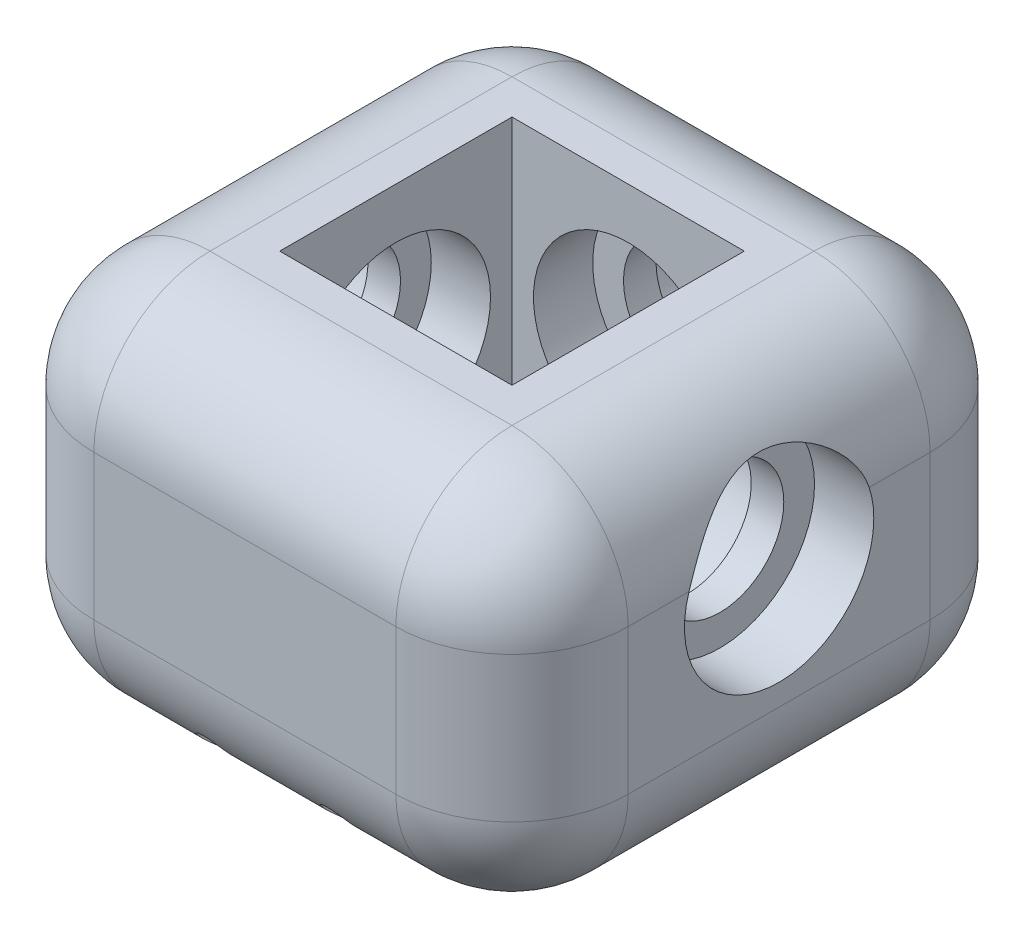
from build123d import *

# Parameters (mm, degrees)
BOSS_EXTRUDE1_DEPTH      = 12.5
BOSS_EXTRUDE1_DEPTH_BACK = 20
SKETCH2_R                = 8.15
CUT_EXTRUDE1_DEPTH       = 5.1
CUT_EXTRUDE2_START       = -5.1
SKETCH3_R                = 8.15
CUT_EXTRUDE2_DEPTH       = 5.1
SKETCH4_R                = 5.5
CUT_EXTRUDE3_DEPTH       = 100
SKETCH5_R                = 8.150000000000011
CUT_EXTRUDE4_DEPTH       = 5.1
CUT_EXTRUDE5_START       = -5.1
SKETCH6_R                = 8.150000000000006
CUT_EXTRUDE5_DEPTH       = 5.1
SKETCH7_R                = 8.15
CUT_EXTRUDE6_DEPTH       = 5.1
CUT_EXTRUDE7_START       = -5.1
SKETCH8_R                = 8.150000000000004
CUT_EXTRUDE7_DEPTH       = 5.1
SKETCH9_R                = 5.5
CUT_EXTRUDE8_DEPTH       = 5.1
FILLET1_R                = 10
BOSS_EXTRUDE2_DEPTH      = 6
SKETCH10_R               = 1.2999999999999996
CUT_EXTRUDE9_DEPTH       = 100
FILLET2_R                = 5


with BuildPart() as part:
    # Sketch1 → Boss-Extrude1 (new, two sides: drawn at the far end of the back side and taken through both)
    with BuildSketch(Plane(origin=(0, 0, 0), x_dir=(1, 0, 0), z_dir=(0, 1, 0)).offset(-BOSS_EXTRUDE1_DEPTH_BACK)):
        Polygon((22.999999999999993, 23), (-22.999999999999993, 22.999999999999993), (-22.999999999999993, -23.000000000000007), (23.000000000000007, -23), align=None)
        Polygon((10, 9.999999999999998), (-10, 9.999999999999996), (-10, -10.000000000000004), (10.000000000000002, -10.000000000000002), align=None, mode=Mode.SUBTRACT)
    extrude(amount=BOSS_EXTRUDE1_DEPTH + BOSS_EXTRUDE1_DEPTH_BACK)

    # Sketch2 → Cut-Extrude1 (cut)
    with BuildSketch(Plane.ZY.offset(22.999999999999993)):
        Circle(SKETCH2_R)
    extrude(amount=-CUT_EXTRUDE1_DEPTH, mode=Mode.SUBTRACT)

    # Sketch3 → Cut-Extrude2 (cut)
    with BuildSketch(Plane(origin=(-10, 0, 0), x_dir=(0, 0, -1), z_dir=(1, 0, 0)).offset(CUT_EXTRUDE2_START)):
        with Locations(Location((1.73e-15, 0, 0), (0, 0, 180))):
            Circle(SKETCH3_R)
    extrude(amount=CUT_EXTRUDE2_DEPTH, mode=Mode.SUBTRACT)

    # Sketch4 → Cut-Extrude3 (cut)
    with BuildSketch(Plane.ZY.offset(17.89999999999999)):
        Circle(SKETCH4_R)
    extrude(amount=-CUT_EXTRUDE3_DEPTH, mode=Mode.SUBTRACT)

    # Sketch5 → Cut-Extrude4 (cut)
    with BuildSketch(Plane.ZY.offset(-10)):
        Circle(SKETCH5_R)
    extrude(amount=-CUT_EXTRUDE4_DEPTH, mode=Mode.SUBTRACT)

    # Sketch6 → Cut-Extrude5 (cut)
    with BuildSketch(Plane(origin=(23, 0, -6.94e-15), x_dir=(-3e-16, 0, -1), z_dir=(1, 0, -3e-16)).offset(CUT_EXTRUDE5_START)):
        with Locations(Location((0, 0, 0), (0, 0, 180))):
            Circle(SKETCH6_R)
    extrude(amount=CUT_EXTRUDE5_DEPTH, mode=Mode.SUBTRACT)

    # Sketch7 → Cut-Extrude6 (cut)
    with BuildSketch(Plane(origin=(-3.47e-15, 0, -22.999999999999996), x_dir=(-1, 0, 1.5e-16), z_dir=(-1.5e-16, 0, -1))):
        Circle(SKETCH7_R)
    extrude(amount=-CUT_EXTRUDE6_DEPTH, mode=Mode.SUBTRACT)

    # Sketch8 → Cut-Extrude7 (cut)
    with BuildSketch(Plane.XY.offset(-9.999999999999998).offset(CUT_EXTRUDE7_START)):
        with Locations(Location((8.7e-16, 0, 0), (0, 0, 180))):
            Circle(SKETCH8_R)
    extrude(amount=CUT_EXTRUDE7_DEPTH, mode=Mode.SUBTRACT)

    # Sketch9 → Cut-Extrude8 (cut)
    with BuildSketch(Plane(origin=(-2.7e-15, 0, -17.899999999999995), x_dir=(-1, 0, 1.5e-16), z_dir=(-1.5e-16, 0, -1))):
        Circle(SKETCH9_R)
    extrude(amount=-CUT_EXTRUDE8_DEPTH, mode=Mode.SUBTRACT)

    # Fillet1
    # the kernel refuses this fillet: 10 mm, written as the material it takes off along each edge
    with BuildSketch(Plane(origin=(13.000000000000004, -10, 13.000000000000002), x_dir=(0, -1, 0), z_dir=(1, 0, -3.1e-16))) as fillet1_piece_1_section:
        Polygon((0, 0), (FILLET1_R, 0), (FILLET1_R, -FILLET1_R), (0, -FILLET1_R), align=None)
    fillet1_piece_1 = extrude(amount=FILLET1_R, mode=Mode.PRIVATE)
    fillet1_piece_1 = fillet1_piece_1 - Plane(origin=(13.000000000000004, -10, 13.000000000000002), x_dir=(0, 0.7071067811865475, -0.7071067811865475), z_dir=(1, 0, -3.1e-16)) * Sphere(FILLET1_R, mode=Mode.PRIVATE)
    add(fillet1_piece_1, mode=Mode.SUBTRACT)
    with BuildSketch(Plane(origin=(12.999999999999996, -10, -13), x_dir=(1, 0, -3.1e-16), z_dir=(-1.5e-16, 0, -1))) as fillet1_piece_2_section:
        Polygon((0, 0), (FILLET1_R, 0), (FILLET1_R, FILLET1_R), (0, FILLET1_R), align=None)
    fillet1_piece_2 = extrude(amount=FILLET1_R, mode=Mode.PRIVATE)
    fillet1_piece_2 = fillet1_piece_2 - Plane(origin=(12.999999999999996, -10, -13), x_dir=(-0.7071067811865475, 0.7071067811865475, 0), z_dir=(-1.5e-16, 0, -1)) * Sphere(FILLET1_R, mode=Mode.PRIVATE)
    add(fillet1_piece_2, mode=Mode.SUBTRACT)
    with BuildSketch(Plane(origin=(-12.999999999999991, -10, -12.999999999999993), x_dir=(0, -1, 0), z_dir=(-1.5e-16, 0, -1))) as fillet1_piece_3_section:
        Polygon((0, 0), (FILLET1_R, 0), (FILLET1_R, FILLET1_R), (0, FILLET1_R), align=None)
    fillet1_piece_3 = extrude(amount=FILLET1_R, mode=Mode.PRIVATE)
    fillet1_piece_3 = fillet1_piece_3 - Plane(origin=(-12.999999999999991, -10, -12.999999999999993), x_dir=(0.7071067811865475, 0.7071067811865475, 0), z_dir=(-1.5e-16, 0, -1)) * Sphere(FILLET1_R, mode=Mode.PRIVATE)
    add(fillet1_piece_3, mode=Mode.SUBTRACT)
    with BuildSketch(Plane(origin=(-12.999999999999991, 2.5, -12.999999999999993), x_dir=(0, 1, 0), z_dir=(-1.5e-16, 0, -1))) as fillet1_piece_4_section:
        Polygon((0, 0), (FILLET1_R, 0), (FILLET1_R, -FILLET1_R), (0, -FILLET1_R), align=None)
    fillet1_piece_4 = extrude(amount=FILLET1_R, mode=Mode.PRIVATE)
    fillet1_piece_4 = fillet1_piece_4 - Plane(origin=(-12.999999999999991, 2.5, -12.999999999999993), x_dir=(0.7071067811865475, -0.7071067811865475, 0), z_dir=(-1.5e-16, 0, -1)) * Sphere(FILLET1_R, mode=Mode.PRIVATE)
    add(fillet1_piece_4, mode=Mode.SUBTRACT)
    with BuildSketch(Plane(origin=(-12.999999999999993, 2.5, 13.000000000000005), x_dir=(-1, 0, 0), z_dir=(0, 1, 0))) as fillet1_piece_5_section:
        Polygon((0, 0), (FILLET1_R, 0), (FILLET1_R, FILLET1_R), (-1.54e-15, FILLET1_R), align=None)
    fillet1_piece_5 = extrude(amount=FILLET1_R, mode=Mode.PRIVATE)
    fillet1_piece_5 = fillet1_piece_5 - Plane(origin=(-12.999999999999993, 2.5, 13.000000000000005), x_dir=(0.7071067811865475, 0, -0.7071067811865476), z_dir=(0, 1, 0)) * Sphere(FILLET1_R, mode=Mode.PRIVATE)
    add(fillet1_piece_5, mode=Mode.SUBTRACT)
    with BuildSketch(Plane(origin=(13.000000000000004, 2.5, 13.000000000000002), x_dir=(0, 1, 0), z_dir=(1, 0, -3.1e-16))) as fillet1_piece_6_section:
        Polygon((0, 0), (FILLET1_R, 0), (FILLET1_R, FILLET1_R), (0, FILLET1_R), align=None)
    fillet1_piece_6 = extrude(amount=FILLET1_R, mode=Mode.PRIVATE)
    fillet1_piece_6 = fillet1_piece_6 - Plane(origin=(13.000000000000004, 2.5, 13.000000000000002), x_dir=(0, -0.7071067811865475, -0.7071067811865475), z_dir=(1, 0, -3.1e-16)) * Sphere(FILLET1_R, mode=Mode.PRIVATE)
    add(fillet1_piece_6, mode=Mode.SUBTRACT)
    with BuildSketch(Plane(origin=(12.999999999999996, 2.5, -13), x_dir=(1, 0, -3.1e-16), z_dir=(-1.5e-16, 0, -1))) as fillet1_piece_7_section:
        Polygon((0, 0), (FILLET1_R, 0), (FILLET1_R, -FILLET1_R), (0, -FILLET1_R), align=None)
    fillet1_piece_7 = extrude(amount=FILLET1_R, mode=Mode.PRIVATE)
    fillet1_piece_7 = fillet1_piece_7 - Plane(origin=(12.999999999999996, 2.5, -13), x_dir=(-0.7071067811865475, -0.7071067811865475, 0), z_dir=(-1.5e-16, 0, -1)) * Sphere(FILLET1_R, mode=Mode.PRIVATE)
    add(fillet1_piece_7, mode=Mode.SUBTRACT)
    with BuildSketch(Plane(origin=(-12.999999999999993, -10, 13.000000000000005), x_dir=(-1, 0, 0), z_dir=(0, -1, 0))) as fillet1_piece_8_section:
        Polygon((0, 0), (FILLET1_R, 0), (FILLET1_R, -FILLET1_R), (-1.54e-15, -FILLET1_R), align=None)
    fillet1_piece_8 = extrude(amount=FILLET1_R, mode=Mode.PRIVATE)
    fillet1_piece_8 = fillet1_piece_8 - Plane(origin=(-12.999999999999993, -10, 13.000000000000005), x_dir=(0.7071067811865475, 0, -0.7071067811865476), z_dir=(0, -1, 0)) * Sphere(FILLET1_R, mode=Mode.PRIVATE)
    add(fillet1_piece_8, mode=Mode.SUBTRACT)
    with BuildSketch(Plane(origin=(23.000000000000004, -20, 12.999999999999998), x_dir=(0, 1, 0), z_dir=(-3.1e-16, 0, -1))) as fillet1_piece_9:
        with BuildLine():
            CenterArc((FILLET1_R, -FILLET1_R), FILLET1_R, 90, 90)
            Line((0, -FILLET1_R), (0, 0))
            Line((0, 0), (FILLET1_R, 0))
        make_face()
    extrude(amount=26.000000000000007, mode=Mode.SUBTRACT)
    with BuildSketch(Plane(origin=(12.999999999999996, -20, -23), x_dir=(0, 1, 0), z_dir=(-1, 0, 1.5e-16))) as fillet1_piece_10:
        with BuildLine():
            CenterArc((FILLET1_R, -FILLET1_R), FILLET1_R, 90, 90)
            Line((0, -FILLET1_R), (0, 0))
            Line((0, 0), (FILLET1_R, 0))
        make_face()
    extrude(amount=25.99999999999999, mode=Mode.SUBTRACT)
    with BuildSketch(Plane(origin=(-22.999999999999993, 12.5, -12.999999999999993), x_dir=(1, 0, 0), z_dir=(0, 0, 1)), Plane(origin=(-12.999999999999993, 12.5, 23.000000000000007), x_dir=(-1.5e-16, 0, -1), z_dir=(1, 0, -1.5e-16))) as fillet1_piece_11:
        with BuildLine():
            CenterArc((FILLET1_R, -FILLET1_R), FILLET1_R, 90, 90)
            Line((0, -FILLET1_R), (0, 0))
            Line((0, 0), (FILLET1_R, 0))
        make_face()
    extrude(amount=26, mode=Mode.SUBTRACT)
    with BuildSketch(Plane(origin=(23.000000000000004, 12.5, 12.999999999999998), x_dir=(0, -1, 0), z_dir=(-3.1e-16, 0, -1))) as fillet1_piece_12:
        with BuildLine():
            CenterArc((FILLET1_R, FILLET1_R), FILLET1_R, 180, 90)
            Line((-1.78e-15, FILLET1_R), (0, 0))
            Line((0, 0), (FILLET1_R, 0))
        make_face()
    extrude(amount=26.000000000000007, mode=Mode.SUBTRACT)
    with BuildSketch(Plane(origin=(12.999999999999996, 12.5, -23), x_dir=(0, -1, 0), z_dir=(-1, 0, 1.5e-16))) as fillet1_piece_13:
        with BuildLine():
            CenterArc((FILLET1_R, FILLET1_R), FILLET1_R, 180, 90)
            Line((-1.78e-15, FILLET1_R), (0, 0))
            Line((0, 0), (FILLET1_R, 0))
        make_face()
    extrude(amount=25.99999999999999, mode=Mode.SUBTRACT)
    with BuildSketch(Plane(origin=(-22.999999999999993, -20, -12.999999999999993), x_dir=(1, 0, 0), z_dir=(0, 0, 1)), Plane(origin=(-12.999999999999993, -20, 23.000000000000007), x_dir=(-1.5e-16, 0, -1), z_dir=(1, 0, -1.5e-16))) as fillet1_piece_14:
        with BuildLine():
            CenterArc((FILLET1_R, FILLET1_R), FILLET1_R, 180, 90)
            Line((0, FILLET1_R), (0, 0))
            Line((0, 0), (FILLET1_R, 0))
        make_face()
    extrude(amount=26, mode=Mode.SUBTRACT)
    with BuildSketch(Plane(origin=(-22.999999999999993, -10, -22.999999999999993), x_dir=(1, 0, 0), z_dir=(0, 1, 0))) as fillet1_piece_15:
        with BuildLine():
            CenterArc((FILLET1_R, -FILLET1_R), FILLET1_R, 90.00000000000001, 89.99999999999999)
            Line((0, -FILLET1_R), (0, 0))
            Line((0, 0), (FILLET1_R, 0))
        make_face()
    extrude(amount=12.5, mode=Mode.SUBTRACT)
    with BuildSketch(Plane(origin=(22.999999999999993, 2.5, -23), x_dir=(-1, 0, 0), z_dir=(0, -1, 0))) as fillet1_piece_16:
        with BuildLine():
            CenterArc((FILLET1_R, -FILLET1_R), FILLET1_R, 89.99999999999999, 90.00000000000001)
            Line((-3.55e-15, -FILLET1_R), (0, 0))
            Line((0, 0), (FILLET1_R, 0))
        make_face()
    extrude(amount=12.5, mode=Mode.SUBTRACT)
    with BuildSketch(Plane(origin=(23.000000000000007, 2.5, 23), x_dir=(-3.6e-16, 0, -1), z_dir=(0, -1, 0))) as fillet1_piece_17:
        with BuildLine():
            CenterArc((FILLET1_R, -FILLET1_R), FILLET1_R, 90, 90)
            Line((3.55e-15, -FILLET1_R), (0, 0))
            Line((0, 0), (FILLET1_R, 0))
        make_face()
    extrude(amount=12.5, mode=Mode.SUBTRACT)
    with BuildSketch(Plane(origin=(-22.999999999999993, -10, 23.000000000000007), x_dir=(0, 0, -1), z_dir=(0, 1, 0))) as fillet1_piece_18:
        with BuildLine():
            CenterArc((FILLET1_R, -FILLET1_R), FILLET1_R, 90, 90)
            Line((0, -FILLET1_R), (0, 0))
            Line((0, 0), (FILLET1_R, 0))
        make_face()
    extrude(amount=12.5, mode=Mode.SUBTRACT)

    # Sketch11 → Boss-Extrude2 (add)
    with BuildSketch(Plane(origin=(8.7e-16, 0, 10.000000000000002), x_dir=(-1, 0, 9e-17), z_dir=(-9e-17, 0, -1))):
        Polygon((7.500000000000003, -12.500000000000002), (-7.499999999999997, -12.500000000000002), (-7.4999999999999964, -20.000000000000004), (7.500000000000002, -20), align=None)
    extrude(amount=BOSS_EXTRUDE2_DEPTH)

    # Sketch10 → Cut-Extrude9 (cut)
    with BuildSketch(Plane(origin=(0, 0, 4.000000000000002), x_dir=(-1, 0, 0), z_dir=(0, 0, -1))):
        with Locations((5.345, -17)):
            Circle(SKETCH10_R)
        with Locations((-5.335, -17.000000000000004)):
            Circle(SKETCH10_R)
    extrude(amount=-CUT_EXTRUDE9_DEPTH, mode=Mode.SUBTRACT)

    # Fillet2
    # the kernel refuses this fillet: 5 mm, written as the material it adds along each edge
    with BuildSketch(Plane(origin=(-7.500000000000002, -12.500000000000002, 10.000000000000002), x_dir=(0, 1, 3.6e-16), z_dir=(1, 0, -9e-17))) as fillet2_piece_1:
        with BuildLine():
            CenterArc((FILLET2_R, -FILLET2_R), FILLET2_R, 89.99999999999999, 90.00000000000001)
            Line((-3.55e-15, -FILLET2_R), (-FILLET2_R * 0.02, -FILLET2_R))
            Line((-FILLET2_R * 0.02, -FILLET2_R), (-FILLET2_R * 0.02, FILLET2_R * 0.02))
            Line((-FILLET2_R * 0.02, FILLET2_R * 0.02), (FILLET2_R, FILLET2_R * 0.02))
            Line((FILLET2_R, FILLET2_R * 0.02), (FILLET2_R, 0))
        make_face()
    extrude(amount=15)
    with BuildSketch(Plane(origin=(-7.500000000000001, -20, 10.000000000000002), x_dir=(-1, -1.2e-16, -7.176e-14), z_dir=(-1.2e-16, 1, 0))) as fillet2_piece_2:
        with BuildLine():
            CenterArc((5.00000000000031, -4.3301270189220755), FILLET2_R, 120.00000000000271, 60.000000000001364)
            Line((3.0986e-13, -4.330127018922434), (-0.09999999999968978, -4.3301270189224415))
            Line((-0.09999999999968978, -4.3301270189224415), (-0.09999999999999964, -7.18e-15))
            Line((-0.09999999999999964, -7.18e-15), (-7.18e-15, 0.09999999999999964))
            ThreePointArc((-7.18e-15, 0.09999999999999964), (1.2500000000000435, 0.10000000000009113), (2.4500000000001005, 0.08660254037844158))
            Line((2.4500000000001005, 0.08660254037844158), (2.500000000000104, 0))
        make_face()
    extrude(amount=7.499999999999998)
    with BuildSketch(Plane(origin=(7.499999999999998, -12.500000000000002, 10.000000000000002), x_dir=(1, -1.2e-16, -7.248e-14), z_dir=(-1.2e-16, -1, 0))) as fillet2_piece_3:
        with BuildLine():
            CenterArc((5.0000000000003135, -4.3301270189220755), FILLET2_R, 120.00000000000271, 60.00000000000142)
            Line((3.1383e-13, -4.330127018922438), (-0.09999999999968581, -4.330127018922445))
            Line((-0.09999999999968581, -4.330127018922445), (-0.09999999999999964, -7.25e-15))
            Line((-0.09999999999999964, -7.25e-15), (-7.25e-15, 0.09999999999999964))
            ThreePointArc((-7.25e-15, 0.09999999999999964), (1.2500000000000513, 0.10000000000009024), (2.450000000000105, 0.08660254037844155))
            Line((2.450000000000105, 0.08660254037844155), (2.5000000000001084, 0))
        make_face()
    extrude(amount=7.500000000000002)
    with BuildSketch(Plane(origin=(-7.500000000000001, -20, 10.000000000000002), x_dir=(-1, -1.2e-16, -7.176e-14), z_dir=(-1.2e-16, 1, 0))) as fillet2_piece_4a_section:
        with BuildLine():
            CenterArc((5.00000000000031, -4.3301270189220755), FILLET2_R, 120.00000000000271, 60.000000000001364)
            Line((3.0986e-13, -4.330127018922434), (-0.09999999999968978, -4.3301270189224415))
            Line((-0.09999999999968978, -4.3301270189224415), (-0.09999999999999964, -7.18e-15))
            Line((-0.09999999999999964, -7.18e-15), (-7.18e-15, 0.09999999999999964))
            ThreePointArc((-7.18e-15, 0.09999999999999964), (1.2500000000000435, 0.10000000000009113), (2.4500000000001005, 0.08660254037844158))
            Line((2.4500000000001005, 0.08660254037844158), (2.500000000000104, 0))
        make_face()
    fillet2_piece_4a = extrude(amount=18.325317547306078, mode=Mode.PRIVATE)
    fillet2_piece_4a = split(fillet2_piece_4a, bisect_by=Plane(origin=(-8.14758355532625, -12.500000000000002, 8.918447770804566), z_dir=(0, 1, 0)), keep=Keep.TOP, mode=Mode.PRIVATE)
    with BuildSketch(Plane(origin=(-20.000000000000004, -12.500000000000002, 10.000000000000005), x_dir=(0, 1, 0), z_dir=(1, 0, -9e-17))) as fillet2_piece_4b_section:
        with BuildLine():
            CenterArc((FILLET2_R, -FILLET2_R), FILLET2_R, 90, 90)
            Line((-1.78e-15, -FILLET2_R), (-FILLET2_R * 0.02, -FILLET2_R))
            Line((-FILLET2_R * 0.02, -FILLET2_R), (-FILLET2_R * 0.02, FILLET2_R * 0.02))
            Line((-FILLET2_R * 0.02, FILLET2_R * 0.02), (FILLET2_R, FILLET2_R * 0.02))
            Line((FILLET2_R, FILLET2_R * 0.02), (FILLET2_R, 0))
        make_face()
    fillet2_piece_4b = extrude(amount=27.5, mode=Mode.PRIVATE)
    fillet2_piece_4b = split(fillet2_piece_4b, bisect_by=Plane(origin=(-7.500000000000002, -11.368024428665873, 8.868024428665876), z_dir=(-1, -1.2e-16, 9e-17)), keep=Keep.TOP, mode=Mode.PRIVATE)
    fillet2_piece_4 = fillet2_piece_4a & fillet2_piece_4b
    add(fillet2_piece_4)
    with BuildSketch(Plane(origin=(-7.500000000000002, -12.500000000000002, 10.000000000000002), x_dir=(0, 1, 3.6e-16), z_dir=(1, 0, -9e-17))) as fillet2_piece_5a_section:
        with BuildLine():
            CenterArc((FILLET2_R, -FILLET2_R), FILLET2_R, 89.99999999999999, 90.00000000000001)
            Line((-3.55e-15, -FILLET2_R), (-FILLET2_R * 0.02, -FILLET2_R))
            Line((-FILLET2_R * 0.02, -FILLET2_R), (-FILLET2_R * 0.02, FILLET2_R * 0.02))
            Line((-FILLET2_R * 0.02, FILLET2_R * 0.02), (FILLET2_R, FILLET2_R * 0.02))
            Line((FILLET2_R, FILLET2_R * 0.02), (FILLET2_R, 0))
        make_face()
    fillet2_piece_5a = extrude(amount=27.5, mode=Mode.PRIVATE)
    fillet2_piece_5a = split(fillet2_piece_5a, bisect_by=Plane(origin=(7.499999999999998, -11.368024428665873, 8.868024428665878), z_dir=(1, -1.2e-16, -9e-17)), keep=Keep.TOP, mode=Mode.PRIVATE)
    with BuildSketch(Plane(origin=(7.5, -1.674682452693899, 10.000000000000002), x_dir=(1, -1.2e-16, -7.319e-14), z_dir=(-1.2e-16, -1, 0))) as fillet2_piece_5b_section:
        with BuildLine():
            CenterArc((5.000000000000317, -4.330127018922071), FILLET2_R, 120.00000000000279, 60.00000000000142)
            Line((3.169e-13, -4.330127018922437), (-0.09999999999968275, -4.330127018922444))
            Line((-0.09999999999968275, -4.330127018922444), (-0.09999999999999964, -7.32e-15))
            Line((-0.09999999999999964, -7.32e-15), (-7.32e-15, 0.09999999999999964))
            ThreePointArc((-7.32e-15, 0.09999999999999964), (1.2500000000000495, 0.10000000000009113), (2.450000000000103, 0.0866025403784415))
            Line((2.450000000000103, 0.0866025403784415), (2.5000000000001066, 0))
        make_face()
    fillet2_piece_5b = extrude(amount=18.325317547306106, mode=Mode.PRIVATE)
    fillet2_piece_5b = split(fillet2_piece_5b, bisect_by=Plane(origin=(8.147583555326294, -12.500000000000002, 8.91844777080445), z_dir=(0, 1, 0)), keep=Keep.TOP, mode=Mode.PRIVATE)
    fillet2_piece_5 = fillet2_piece_5a & fillet2_piece_5b
    add(fillet2_piece_5)


solid = part.part
